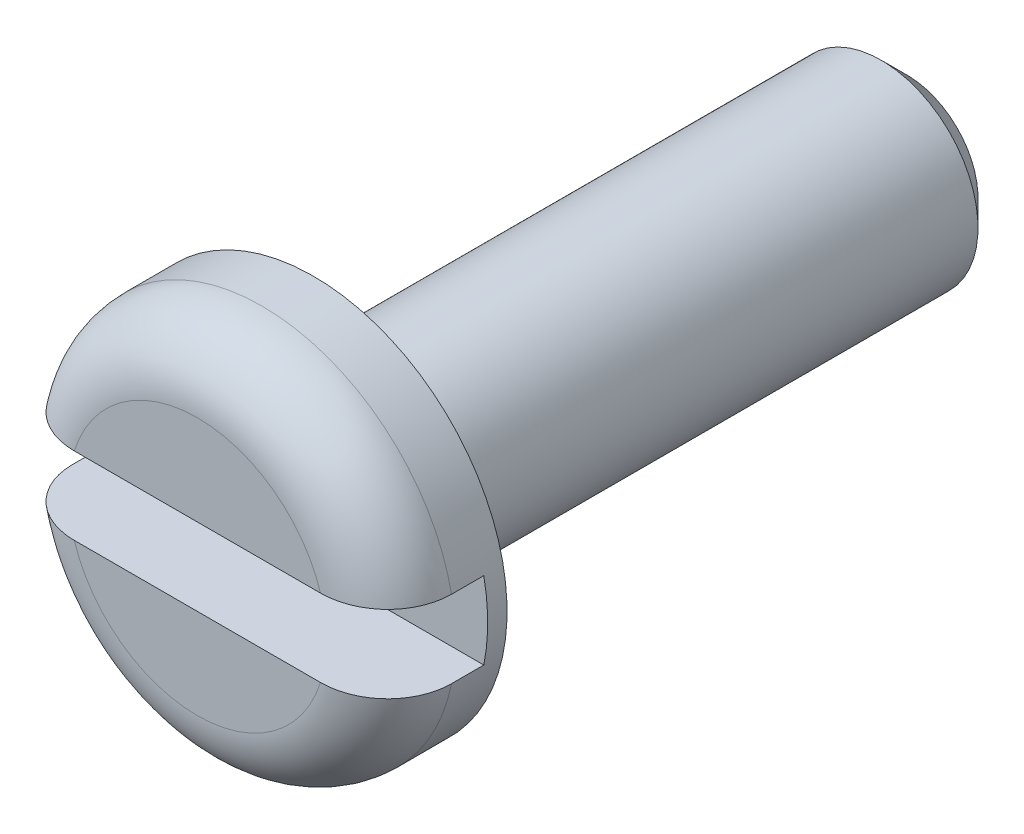
from build123d import *

# Parameters (mm, degrees)
CUT_EXTRUDE_1_DEPTH      = 12.789826123
CUT_EXTRUDE_1_DEPTH_BACK = 12.789826123
SKETCH_2_W               = 1.5
SKETCH_2_H               = 1.2
CHAMFER_1_SIZE           = 0.4
FILLET_1_R               = 1
FILLET_2_R               = 0.4


with BuildPart() as part:
    # Эскиз1 → Повернуть1 (revolve)
    with BuildSketch(Plane(origin=(0, 0, 0), x_dir=(1, 0, 0), z_dir=(0, 1, 0))):
        Polygon((0, 0), (-3, 0), (-3, 1.8), (-1.5, 1.8), (-1.5, 11), (0, 11), align=None)
    revolve(axis=Axis((0, 0, -11), (0, 0, 1)))

    # Эскиз2 → Вырез-Вытянуть1 (cut, two sides: drawn at the far end of the back side and taken through both)
    with BuildSketch(Plane(origin=(0, 0, 0), x_dir=(0, 0, -1), z_dir=(1, 0, 0)).offset(-CUT_EXTRUDE_1_DEPTH_BACK)):
        with Locations((0.75, 0)):
            Rectangle(SKETCH_2_W, SKETCH_2_H)
    extrude(amount=CUT_EXTRUDE_1_DEPTH + CUT_EXTRUDE_1_DEPTH_BACK, mode=Mode.SUBTRACT)

    # Фаска1
    chamfer_1_edges = [part.edges().sort_by_distance(p)[0] for p in [
        (1.5, 0, -11),
    ]]
    chamfer(chamfer_1_edges, length=CHAMFER_1_SIZE)

    # Скругление1
    fillet_1_edges = [part.edges().sort_by_distance(p)[0] for p in [
        (0, -3, 0),
        (0, 3, 0),
    ]]
    fillet(fillet_1_edges, radius=FILLET_1_R)

    # Скругление2
    fillet_2_edges = [part.edges().sort_by_distance(p)[0] for p in [
        (1.5, 0, -1.8),
    ]]
    fillet(fillet_2_edges, radius=FILLET_2_R)


solid = part.part
